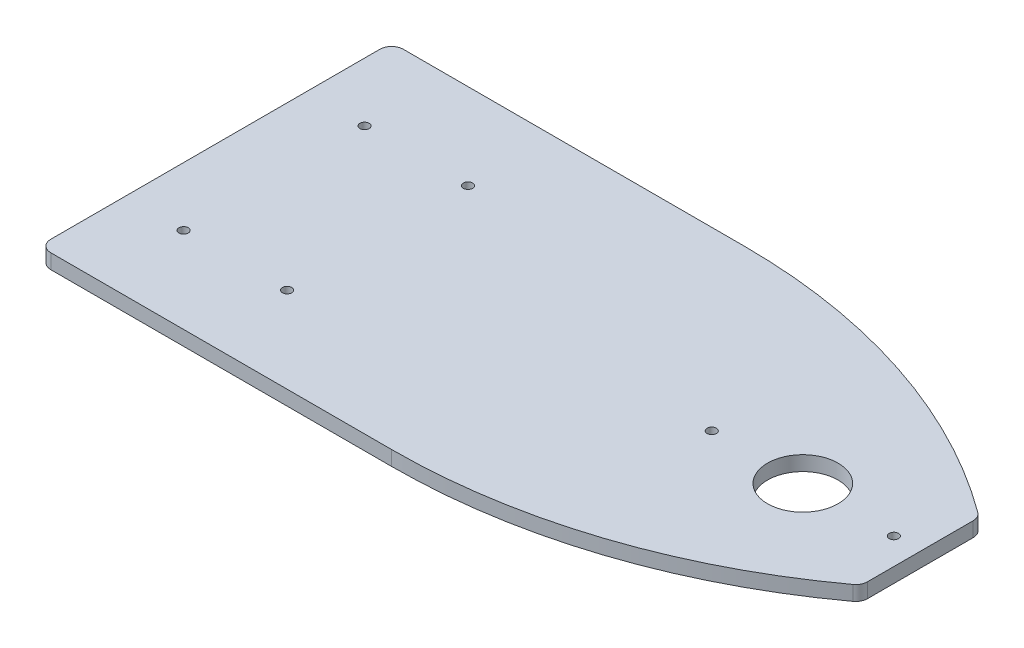
from build123d import *

# Parameters (mm, degrees)
SKETCH1_W           = 152.4
SKETCH1_H           = 76.2
BOSS_EXTRUDE1_DEPTH = 3.175
CUT_EXTRUDE1_DEPTH  = 3.175
FILLET2_R           = 2.54
FILLET3_R           = 2.54
SKETCH5_R           = 7.62
CUT_EXTRUDE2_DEPTH  = 3.175
SKETCH7_R           = 1.0033
CUT_EXTRUDE4_DEPTH  = 86.253332046
SKETCH6_R           = 1.0033
CUT_EXTRUDE5_DEPTH  = 86.253332046


with BuildPart() as part:
    # Sketch1 → Boss-Extrude1 (new body)
    with BuildSketch(Plane(origin=(0, 0, 0), x_dir=(1, 0, 0), z_dir=(0, 1, 0))):
        Rectangle(SKETCH1_W, SKETCH1_H)
    extrude(amount=BOSS_EXTRUDE1_DEPTH)

    # Sketch4 → Cut-Extrude1 (cut)
    with BuildSketch(Plane(origin=(0, 3.175, 0), x_dir=(1, 0, 0), z_dir=(0, 1, 0))):
        with BuildLine():
            Line((0, 38.1), (76.2, 38.1))
            Line((76.2, 38.1), (76.2, 12.7))
            ThreePointArc((76.2, 12.7), (40.160926284, 31.582778852), (0, 38.1))
        make_face()
        with BuildLine():
            Line((76.2, -38.1), (76.2, -12.7))
            ThreePointArc((76.2, -12.7), (40.160926284, -31.582778852), (0, -38.1))
            Line((0, -38.1), (76.2, -38.1))
        make_face()
    extrude(amount=-CUT_EXTRUDE1_DEPTH, mode=Mode.SUBTRACT)

    # Fillet2
    fillet2_edges = [part.edges().sort_by_distance(p)[0] for p in [
        (76.2, 1.5875, 12.7),
        (76.2, 1.5875, -12.7),
    ]]
    fillet(fillet2_edges, radius=FILLET2_R)

    # Fillet3
    fillet3_edges = [part.edges().sort_by_distance(p)[0] for p in [
        (-76.2, 1.5875, 38.1),
        (-76.2, 1.5875, -38.1),
    ]]
    fillet(fillet3_edges, radius=FILLET3_R)

    # Sketch5 → Cut-Extrude2 (cut)
    with BuildSketch(Plane(origin=(0, 3.175, 0), x_dir=(1, 0, 0), z_dir=(0, 1, 0))):
        with Locations((50.8, 0)):
            Circle(SKETCH5_R)
    extrude(amount=-CUT_EXTRUDE2_DEPTH, mode=Mode.SUBTRACT)

    # Sketch7 → Cut-Extrude4 (cut, through all)
    with BuildSketch(Plane(origin=(0, 3.175, 0), x_dir=(1, 0, 0), z_dir=(0, 1, 0))):
        with Locations((70.485, 0)):
            Circle(SKETCH7_R)
        with Locations((31.115, 0)):
            Circle(SKETCH7_R)
    extrude(amount=-CUT_EXTRUDE4_DEPTH, mode=Mode.SUBTRACT)

    # Sketch6 → Cut-Extrude5 (cut, through all)
    with BuildSketch(Plane(origin=(0, 3.175, 0), x_dir=(1, 0, 0), z_dir=(0, 1, 0))):
        with Locations((-41.131290421, -19.558)):
            Circle(SKETCH6_R)
        with Locations((-63.5, -19.558)):
            Circle(SKETCH6_R)
        with Locations((-63.5, 19.558)):
            Circle(SKETCH6_R)
        with Locations((-41.131290421, 19.558)):
            Circle(SKETCH6_R)
    extrude(amount=-CUT_EXTRUDE5_DEPTH, mode=Mode.SUBTRACT)


solid = part.part
